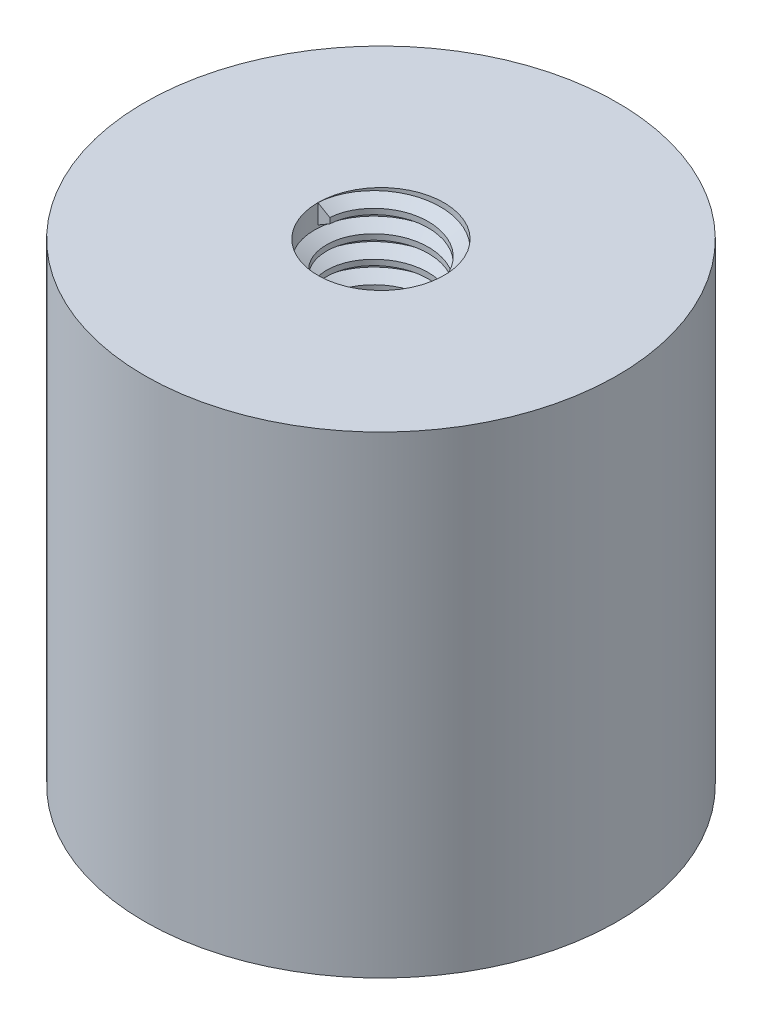
from build123d import *

# Parameters (mm, degrees)
SKETCH1_R                 = 7.5
BOSS_EXTRUDE1_DEPTH       = 15
F_4_0MM_DOWEL_HOLE1_D     = 4
F_4_0MM_DOWEL_HOLE1_DEPTH = 7.0000114
F_4_0MM_DOWEL_HOLE1_TIP   = 1.201721238
THREAD1_PITCH             = 0.7


with BuildPart() as part:
    # Sketch1 → Boss-Extrude1 (new body)
    with BuildSketch(Plane(origin=(0, 0, 0), x_dir=(1, 0, 0), z_dir=(0, 1, 0))):
        with Locations(Location((0, 0, 0), (0, 0, 270))):
            Circle(SKETCH1_R)
    extrude(amount=BOSS_EXTRUDE1_DEPTH)

    # Ø4.0mm Dowel Hole1
    with Locations(Plane(origin=(0, 15, 0), x_dir=(1, 0, 0), z_dir=(0, 1, 0))):
        with Locations((0, 0)):
            Hole(F_4_0MM_DOWEL_HOLE1_D / 2, depth=F_4_0MM_DOWEL_HOLE1_DEPTH)
            with Locations((0, 0, -(F_4_0MM_DOWEL_HOLE1_DEPTH + F_4_0MM_DOWEL_HOLE1_TIP / 2))):  # 118° drill point
                Cone(0, F_4_0MM_DOWEL_HOLE1_D / 2, F_4_0MM_DOWEL_HOLE1_TIP, mode=Mode.SUBTRACT)

    # Thread1: the profile of Thread Profile1 profile screwed along a right-hand helix of 10.000016 turns, 6 arcs to a turn; built about Z, then put on its axis
    thread1_z = Axis((0, 0, 0), (0, 0, 1))
    thread1_corners = [(2.0003, 0, -0.000173205), (2.0003, 0, 0.612673203), (1.621113887, 0, 0.393749999), (1.621113887, 0, 0.218749999)]
    with BuildLine(mode=Mode.PRIVATE) as thread1_profile:
        Line(thread1_corners[0], thread1_corners[1])
        Line(thread1_corners[1], thread1_corners[2])
        Line(thread1_corners[2], thread1_corners[3])
        Line(thread1_corners[3], thread1_corners[0])
    thread1_cap = Face(thread1_profile.wire())
    thread1_turn_angles = [0, 30, 60, 90, 120, 150, 180, 210, 240, 270, 300, 330, 360]
    thread1_turn_weights = [1, 0.8660254037844387, 1, 0.8660254037844387, 1, 0.8660254037844387, 1, 0.8660254037844387, 1, 0.8660254037844387, 1, 0.8660254037844387, 1]
    thread1_turn_rails = [Edge.make_bspline([Vector(p[0], p[1], 0).rotate(thread1_z, thread1_turn_angles[k]) / thread1_turn_weights[k] + Vector(0, 0, p[2] + THREAD1_PITCH * thread1_turn_angles[k] / 360) for k in range(13)], [0, 0, 0, 1, 1, 2, 2, 3, 3, 4, 4, 5, 5, 6, 6, 6], 2, thread1_turn_weights) for p in thread1_corners]
    thread1_turn_sides = [Face.make_surface_from_curves(thread1_turn_rails[p[0]], thread1_turn_rails[p[1]]) for p in [(0, 1), (1, 2), (2, 3), (3, 0)]]
    thread1_last_angles = [3600, 3600.002931429, 3600.005862857]
    thread1_last_weights = [1, 0.9999999986911696, 1]
    thread1_last_rails = [Edge.make_bspline([Vector(p[0], p[1], 0).rotate(thread1_z, thread1_last_angles[k]) / thread1_last_weights[k] + Vector(0, 0, p[2] + THREAD1_PITCH * thread1_last_angles[k] / 360) for k in range(3)], [0, 0, 0, 1, 1, 1], 2, thread1_last_weights) for p in thread1_corners]
    thread1_last_sides = [Face.make_surface_from_curves(thread1_last_rails[p[0]], thread1_last_rails[p[1]]) for p in [(0, 1), (1, 2), (2, 3), (3, 0)]]
    thread1 = Plane(origin=(0, 15, 0), x_dir=(-1, 0, 0), z_dir=(0, -1, 0)) * Solid(Shell([*[p.moved(Location((0, 0, THREAD1_PITCH * i))) for i in range(10) for p in thread1_turn_sides], *thread1_last_sides, thread1_cap, thread1_cap.rotate(thread1_z, 3600.005862857).moved(Location((0, 0, THREAD1_PITCH * 3600.005862857 / 360)))]))
    add(thread1)


solid = part.part
